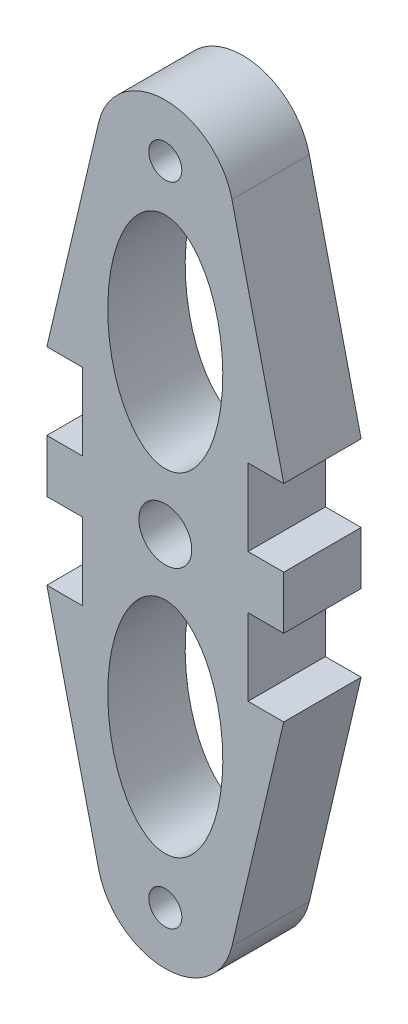
from build123d import *

# Parameters (mm, degrees)
SKETCH1_R           = 1.25
SKETCH1_R_2         = 2
BOSS_EXTRUDE1_DEPTH = 5.85


with BuildPart() as part:
    # Sketch1 → Boss-Extrude1 (new body)
    with BuildSketch(Plane.XY):
        with BuildLine():
            Line((781.409168709, 471.202359197), (781.409168709, 465.402359197))
            Line((781.409168709, 465.402359197), (778.709168709, 465.402359197))
            Line((778.709168709, 465.402359197), (778.709168709, 461.402359197))
            Line((778.709168709, 461.402359197), (781.409168709, 461.402359197))
            Line((781.409168709, 461.402359197), (781.409168709, 455.602359197))
            Line((781.409168709, 455.602359197), (778.709168709, 455.602359197))
            Line((778.709168709, 455.602359197), (782.622695545, 438.967359197))
            ThreePointArc((782.622695545, 438.967359197), (787.659168709, 434.978260714), (792.695641872, 438.967359197))
            Line((792.695641872, 438.967359197), (796.609168709, 455.602359197))
            Line((796.609168709, 455.602359197), (793.909168709, 455.602359197))
            Line((793.909168709, 455.602359197), (793.909168709, 461.402359197))
            Line((793.909168709, 461.402359197), (796.609168709, 461.402359197))
            Line((796.609168709, 461.402359197), (796.609168709, 465.402359197))
            Line((796.609168709, 465.402359197), (793.909168709, 465.402359197))
            Line((793.909168709, 465.402359197), (793.909168709, 471.202359197))
            Line((793.909168709, 471.202359197), (796.609168709, 471.202359197))
            Line((796.609168709, 471.202359197), (792.695641872, 487.837359197))
            ThreePointArc((792.695641872, 487.837359197), (787.659168709, 491.826457679), (782.622695545, 487.837359197))
            Line((782.622695545, 487.837359197), (778.709168709, 471.202359197))
            Line((778.709168709, 471.202359197), (781.409168709, 471.202359197))
        make_face()
        with Locations((787.659168709, 438.967359197)):
            Circle(SKETCH1_R, mode=Mode.SUBTRACT)
        with BuildLine():
            add(Edge.make_bspline(
                [(787.659168709, 442.504519601), (795.187523069, 442.504519601), (791.423345889, 454.957640433), (787.659168709, 467.410761265), (783.894991529, 454.957640433), (780.130814348, 442.504519601), (787.659168709, 442.504519601)],
                knots=[0, 0, 0, 2.094395102, 2.094395102, 4.188790205, 4.188790205, 6.283185307, 6.283185307, 6.283185307], degree=2, weights=[1, 0.5, 1, 0.5, 1, 0.5, 1]))
        make_face(mode=Mode.SUBTRACT)
        with Locations((787.659168709, 487.837359197)):
            Circle(SKETCH1_R, mode=Mode.SUBTRACT)
        with Locations((787.659168709, 463.402359197)):
            Circle(SKETCH1_R_2, mode=Mode.SUBTRACT)
        with BuildLine():
            add(Edge.make_bspline(
                [(787.659168709, 484.300198792), (780.130814348, 484.300198792), (783.894991529, 471.84707796), (787.659168709, 459.393957128), (791.423345889, 471.84707796), (795.187523069, 484.300198792), (787.659168709, 484.300198792)],
                knots=[0, 0, 0, 2.094395102, 2.094395102, 4.188790205, 4.188790205, 6.283185307, 6.283185307, 6.283185307], degree=2, weights=[1, 0.5, 1, 0.5, 1, 0.5, 1]))
        make_face(mode=Mode.SUBTRACT)
    extrude(amount=BOSS_EXTRUDE1_DEPTH)


solid = part.part
